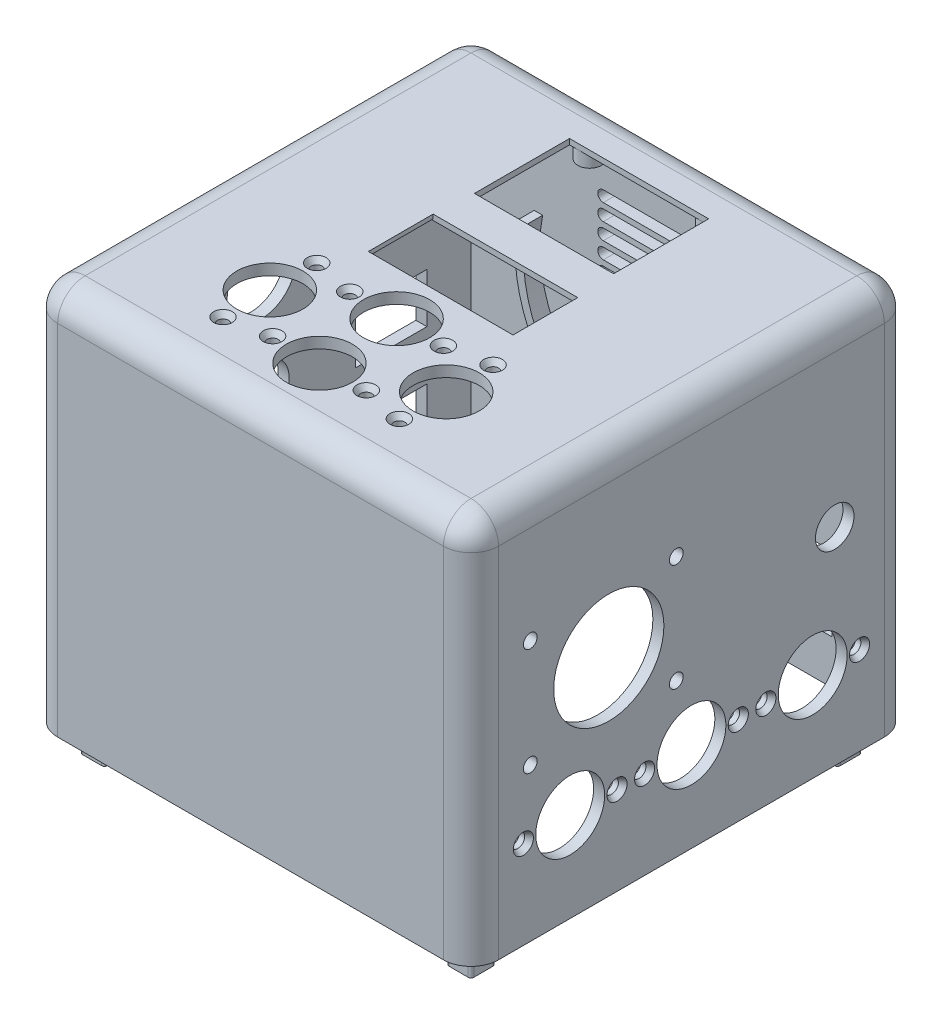
from build123d import *
from OCP.BRepFilletAPI import BRepFilletAPI_MakeChamfer

# Parameters (mm, degrees)
SKETCH1_W              = 80
SKETCH1_H              = 80
BOSS_EXTRUDE1_DEPTH    = 70
SKETCH3_W              = 76
SKETCH3_H              = 76
CUT_EXTRUDE2_DEPTH     = 68
FILLET2_R              = 5
SKETCH4_R              = 2.5
CUT_EXTRUDE4_DEPTH     = 11
SKETCH11_W             = 70
SKETCH11_H             = 65
CUT_EXTRUDE5_DEPTH     = 1.5
SKETCH12_W             = 25.25
SKETCH12_H             = 17.25
SKETCH12_W_2           = 26.25
SKETCH12_H_2           = 11.75
CUT_EXTRUDE6_DEPTH     = 7.5
SKETCH13_R             = 3.5
SKETCH13_R_2           = 10
CUT_EXTRUDE7_DEPTH     = 7.5
SKETCH14_W             = 7
SKETCH14_H             = 9
BOSS_EXTRUDE4_DEPTH    = 7
CUT_EXTRUDE8_DEPTH     = 8
SKETCH17_R             = 1
CUT_EXTRUDE9_DEPTH     = 3
CHAMFER1_SIZE          = 2
FILLET7_R              = 0.5
CIRPATTERN2_COUNT      = 4
SKETCH21_W             = 28.25
SKETCH21_H             = 28.05
SKETCH21_W_2           = 25.25
SKETCH21_H_2           = 17.25
CUT_EXTRUDE11_DEPTH    = 1
SKETCH22_W             = 12
SKETCH22_H             = 2.75
CUT_EXTRUDE12_DEPTH    = 0.75
SKETCH23_W             = 5
SKETCH23_H             = 11.75
CUT_EXTRUDE13_DEPTH    = 1.85
SKETCH24_W             = 6
SKETCH24_H             = 11.75
CUT_EXTRUDE14_DEPTH    = 1.25
SKETCH25_W             = 4
SKETCH25_H             = 9.25
CUT_EXTRUDE15_DEPTH    = 0.5
SKETCH26_W             = 39.25
SKETCH26_H             = 13.75
SKETCH26_W_2           = 26.25
SKETCH26_H_2           = 11.75
CUT_EXTRUDE16_DEPTH    = 1
SKETCH27_R             = 2.125
SKETCH27_R_2           = 1.125
BOSS_EXTRUDE6_DEPTH    = 2.5
SKETCH29_R             = 2.125
SKETCH29_R_2           = 1.125
BOSS_EXTRUDE7_DEPTH    = 2.5
SKETCH31_W             = 2
SKETCH31_H             = 60
SKETCH31_W_2           = 60
SKETCH31_H_2           = 2
EXTRUDE_THIN1_DEPTH    = 3
BOSS_EXTRUDE9_DEPTH    = 5
SKETCH34_W             = 3.5
SKETCH34_H             = 2.25
SKETCH34_W_2           = 2.25
SKETCH34_H_2           = 3.5
CUT_EXTRUDE17_DEPTH    = 1.25
SKETCH37_W             = 30
SKETCH37_H             = 2
CUT_EXTRUDE18_DEPTH    = 5
FILLET6_R              = 1
LPATTERN1_COUNT        = 10
LPATTERN1_PITCH        = 3
FILLET6_OF_LPATTERN1_R = 1
BOSS_EXTRUDE11_DEPTH   = 3
SKETCH41_R             = 5
SKETCH41_R_2           = 6.25
SKETCH41_R_3           = 1.25
SKETCH41_W             = 13
SKETCH41_H             = 9
SKETCH41_W_2           = 8
SKETCH41_H_2           = 4
CUT_EXTRUDE19_DEPTH    = 5
SKETCH42_R             = 6
CUT_EXTRUDE20_DEPTH    = 5
SKETCH43_R             = 6.25
CUT_EXTRUDE21_DEPTH    = 5
SKETCH44_W             = 9
SKETCH44_H             = 13.5
CUT_EXTRUDE22_DEPTH    = 5
SKETCH45_R             = 1
CUT_EXTRUDE23_DEPTH    = 3
SKETCH46_R             = 1
CUT_EXTRUDE24_DEPTH    = 2
CUT_EXTRUDE25_START    = -2
SKETCH47_R             = 6.25
SKETCH47_R_2           = 1.25
CUT_EXTRUDE25_DEPTH    = 2
SKETCH48_R             = 0.75
CUT_EXTRUDE26_DEPTH    = 2
SKETCH36_R             = 1.25
CUT_EXTRUDE27_DEPTH    = 10
CHAMFER3_SIZE          = 1
CHAMFER3_SIZE2         = 0.700207538
SKETCH50_W             = 62
SKETCH50_H             = 2
CUT_EXTRUDE28_DEPTH    = 2
CUT_EXTRUDE29_START    = -14
SKETCH49_R             = 1.125
SKETCH49_R_2           = 5
CUT_EXTRUDE29_DEPTH    = 14
CHAMFER2_SIZE          = 1
CHAMFER2_SIZE2         = 0.577350269


with BuildPart() as part:
    # Sketch1 → Boss-Extrude1 (new body)
    with BuildSketch(Plane(origin=(0, 0, 0), x_dir=(1, 0, 0), z_dir=(0, 1, 0))):
        Rectangle(SKETCH1_W, SKETCH1_H)
    extrude(amount=-BOSS_EXTRUDE1_DEPTH)

    # Sketch3 → Cut-Extrude2 (cut)
    with BuildSketch(Plane.XZ.offset(70)):
        Rectangle(SKETCH3_W, SKETCH3_H)
    extrude(amount=-CUT_EXTRUDE2_DEPTH, mode=Mode.SUBTRACT)

    # Fillet2
    fillet2_edges = [part.edges().sort_by_distance(p)[0] for p in [
        (38, -2, 0),
        (-38, -2, 0),
        (0, 0, 40),
        (-40, 0, 0),
        (0, 0, -40),
        (40, 0, 0),
        (40, -35, 40),
        (-40, -35, 40),
        (-40, -35, -40),
        (40, -35, -40),
    ]]
    fillet(fillet2_edges, radius=FILLET2_R)

    # Sketch4 → Cut-Extrude4 (cut)
    with BuildSketch(Plane(origin=(0, 0, -40), x_dir=(-1, 0, 0), z_dir=(0, 0, -1))):
        with Locations((0, -59)):
            Circle(SKETCH4_R)
    extrude(amount=-CUT_EXTRUDE4_DEPTH, mode=Mode.SUBTRACT)

    # Sketch11 → Cut-Extrude5 (cut)
    with BuildSketch(Plane(origin=(0, 0, 38), x_dir=(-1, 0, 0), z_dir=(0, 0, -1))):
        with Locations((0, -37.5)):
            Rectangle(SKETCH11_W, SKETCH11_H)
    extrude(amount=-CUT_EXTRUDE5_DEPTH, mode=Mode.SUBTRACT)

    # Sketch12 → Cut-Extrude6 (cut)
    with BuildSketch(Plane(origin=(0, 0, 0), x_dir=(1, 0, 0), z_dir=(0, 1, 0))):
        with Locations((0, 21.875)):
            Rectangle(SKETCH12_W, SKETCH12_H)
        with Locations((0, 0.375)):
            Rectangle(SKETCH12_W_2, SKETCH12_H_2)
    extrude(amount=-CUT_EXTRUDE6_DEPTH, mode=Mode.SUBTRACT)

    # Sketch13 → Cut-Extrude7 (cut)
    with BuildSketch(Plane(origin=(40, 0, 0), x_dir=(0, 0, -1), z_dir=(1, 0, 0))):
        with Locations((26, -32.5)):
            Circle(SKETCH13_R)
        with Locations((-15, -32.5)):
            Circle(SKETCH13_R_2)
    extrude(amount=-CUT_EXTRUDE7_DEPTH, mode=Mode.SUBTRACT)

    # Sketch21 → Cut-Extrude11 (cut)
    with BuildSketch(Plane.XZ.offset(2)):
        with Locations((0, -21.875)):
            Rectangle(SKETCH21_W, SKETCH21_H)
        with Locations((0, -21.875)):
            Rectangle(SKETCH21_W_2, SKETCH21_H_2, mode=Mode.SUBTRACT)
    extrude(amount=-CUT_EXTRUDE11_DEPTH, mode=Mode.SUBTRACT)

    # Sketch22 → Cut-Extrude12 (cut)
    with BuildSketch(Plane.XZ.offset(1)):
        with Locations((0, -9.725)):
            Rectangle(SKETCH22_W, SKETCH22_H)
    extrude(amount=-CUT_EXTRUDE12_DEPTH, mode=Mode.SUBTRACT)

    # Sketch23 → Cut-Extrude13 (cut)
    with BuildSketch(Plane.XZ.offset(2)):
        with Locations((15.625, -0.375)):
            Rectangle(SKETCH23_W, SKETCH23_H)
    extrude(amount=-CUT_EXTRUDE13_DEPTH, mode=Mode.SUBTRACT)

    # Sketch24 → Cut-Extrude14 (cut)
    with BuildSketch(Plane.XZ.offset(2)):
        with Locations((-16.125, -0.375)):
            Rectangle(SKETCH24_W, SKETCH24_H)
    extrude(amount=-CUT_EXTRUDE14_DEPTH, mode=Mode.SUBTRACT)

    # Sketch25 → Cut-Extrude15 (cut)
    with BuildSketch(Plane.XZ.offset(0.75)):
        with Locations((-16.625, -0.375)):
            Rectangle(SKETCH25_W, SKETCH25_H)
    extrude(amount=-CUT_EXTRUDE15_DEPTH, mode=Mode.SUBTRACT)

    # Sketch26 → Cut-Extrude16 (cut)
    with BuildSketch(Plane.XZ.offset(2)):
        with Locations((-0.5, -0.375)):
            Rectangle(SKETCH26_W, SKETCH26_H)
        with Locations((0, -0.375)):
            Rectangle(SKETCH26_W_2, SKETCH26_H_2, mode=Mode.SUBTRACT)
    extrude(amount=-CUT_EXTRUDE16_DEPTH, mode=Mode.SUBTRACT)

    # Sketch27 → Boss-Extrude6 (add)
    # profile 1 of 2: a face of its own
    with BuildSketch(Plane.XZ.offset(1)):
        with Locations(Location((-11.125, -11.1, 0), (0, 0, 90))):
            Circle(SKETCH27_R)
        with Locations(Location((-11.125, -11.1, 0), (0, 0, 270))):
            Circle(SKETCH27_R_2, mode=Mode.SUBTRACT)
    # profile 2 of 2: a face of its own
    with BuildSketch(Plane.XZ.offset(1)):
        with Locations(Location((-11.125, -32.65, 0), (0, 0, 90))):
            Circle(SKETCH27_R)
        with Locations(Location((-11.125, -32.65, 0), (0, 0, 270))):
            Circle(SKETCH27_R_2, mode=Mode.SUBTRACT)
    boss_extrude6 = extrude(amount=BOSS_EXTRUDE6_DEPTH)

    # Mirror1: Boss-Extrude6 across plane
    add(boss_extrude6.mirror(Plane(origin=(0, 0, 0), x_dir=(0, 0, 1), z_dir=(1, 0, 0))))

    # Sketch29 → Boss-Extrude7 (add)
    with BuildSketch(Plane.XZ.offset(2)):
        with Locations(Location((-22.5, -0.375, 0), (0, 0, 90))):
            Circle(SKETCH29_R)
        with Locations(Location((-22.5, -0.375, 0), (0, 0, 270))):
            Circle(SKETCH29_R_2, mode=Mode.SUBTRACT)
    boss_extrude7 = extrude(amount=BOSS_EXTRUDE7_DEPTH)

    # Mirror2: Boss-Extrude7 across plane
    add(boss_extrude7.mirror(Plane(origin=(0, 0, 0), x_dir=(0, 0, 1), z_dir=(1, 0, 0))))



with BuildPart() as body_2:
    # Sketch14 → Boss-Extrude4 (new body)
    with BuildSketch(Plane(origin=(-38, 0, 0), x_dir=(0, 0, -1), z_dir=(1, 0, 0))):
        with Locations((34.5, -70.5)):
            Rectangle(SKETCH14_W, SKETCH14_H)
    extrude(amount=BOSS_EXTRUDE4_DEPTH)

    # Sketch16 → Cut-Extrude8 (cut)
    with BuildSketch(Plane.XZ.offset(75)):
        Polygon((-38, -31), (-38, -38), (-31, -38), (-31, -35.5), (-35.5, -35.5), (-35.5, -31), align=None)
    extrude(amount=-CUT_EXTRUDE8_DEPTH, mode=Mode.SUBTRACT)

    # Sketch17 → Cut-Extrude9 (cut)
    with BuildSketch(Plane.XZ.offset(75)):
        with Locations(Location((-33.25, -33.25, 0), (0, 0, 270))):
            Circle(SKETCH17_R)
    extrude(amount=-CUT_EXTRUDE9_DEPTH, mode=Mode.SUBTRACT)

    # Chamfer1
    chamfer1_edges = [body_2.edges().sort_by_distance(p)[0] for p in [
        (-31, -70.5, -31),
    ]]
    chamfer(chamfer1_edges, length=CHAMFER1_SIZE)

    # Fillet7
    fillet7_edges = [body_2.edges().sort_by_distance(p)[0] for p in [
        (-35.5, -71, -31),
        (-35.5, -71, -35.5),
        (-31, -71, -35.5),
        (-31, -70.5, -33),
        (-33, -70.5, -31),
    ]]
    fillet(fillet7_edges, radius=FILLET7_R)


with BuildPart() as cirpattern2_1:
    # CirPattern2: pattern copy
    add(body_2.part.rotate(Axis((0, 0, 0), (0, 1, 0)), 1 * 360 / CIRPATTERN2_COUNT))


with BuildPart() as cirpattern2_2:
    # CirPattern2: pattern copy
    add(body_2.part.rotate(Axis((0, 0, 0), (0, 1, 0)), 2 * 360 / CIRPATTERN2_COUNT))


with BuildPart() as cirpattern2_3:
    # CirPattern2: pattern copy
    add(body_2.part.rotate(Axis((0, 0, 0), (0, 1, 0)), 3 * 360 / CIRPATTERN2_COUNT))


with BuildPart() as part_1:
    add(part.part)

    add(cirpattern2_1.part)  # Extrude-Thin1 merges CirPattern2_1

    add(cirpattern2_2.part)  # Extrude-Thin1 merges CirPattern2_2
    # Sketch31 → Extrude-Thin1 (add)
    with BuildSketch(Plane(origin=(0, 0, 39.5), x_dir=(-1, 0, 0), z_dir=(0, 0, -1))):
        with Locations((0, -37)):
            Rectangle(SKETCH31_W, SKETCH31_H)
        with Locations((0, -37)):
            Rectangle(SKETCH31_W_2, SKETCH31_H_2)
        with Locations((-15, -37)):
            Rectangle(SKETCH31_W, SKETCH31_H)
        Polygon((-29, -67), (-29, -8), (29, -8), (29, -67), (31, -67), (31, -6), (-31, -6), (-31, -67), align=None)
        with Locations((15, -37)):
            Rectangle(SKETCH31_W, SKETCH31_H)
        with Locations((0, -22)):
            Rectangle(SKETCH31_W_2, SKETCH31_H_2)
        with Locations((0, -52)):
            Rectangle(SKETCH31_W_2, SKETCH31_H_2)
    extrude(amount=EXTRUDE_THIN1_DEPTH)

    # Sketch33 → Boss-Extrude9 (add)
    with BuildSketch(Plane.XY.offset(-38)):
        with BuildLine():
            Line((-5.454356057, -56.5), (-7.071067812, -56.5))
            ThreePointArc((-7.071067812, -56.5), (-1.26826484, -66.391989197), (7.5, -59))
            ThreePointArc((7.5, -59), (7.391989197, -57.73173516), (7.071067812, -56.5))
            Line((7.071067812, -56.5), (5.454356057, -56.5))
            ThreePointArc((5.454356057, -56.5), (5.862002062, -57.720573633), (6, -59))
            ThreePointArc((6, -59), (-1.279426367, -64.862002062), (-5.454356057, -56.5))
        make_face()
    extrude(amount=BOSS_EXTRUDE9_DEPTH)

    # Sketch34 → Cut-Extrude17 (cut)
    with BuildSketch(Plane.ZY.offset(-38)):
        with Locations((-26, -40.625)):
            Rectangle(SKETCH34_W, SKETCH34_H)
        with Locations((-17.875, -32.5)):
            Rectangle(SKETCH34_W_2, SKETCH34_H_2)
        with Locations((-34.125, -32.5)):
            Rectangle(SKETCH34_W_2, SKETCH34_H_2)
        with Locations((-26, -24.375)):
            Rectangle(SKETCH34_W, SKETCH34_H)
    extrude(amount=-CUT_EXTRUDE17_DEPTH, mode=Mode.SUBTRACT)

    # Sketch37 → Cut-Extrude18 (cut)
    with BuildSketch(Plane(origin=(0, 0, -40), x_dir=(-1, 0, 0), z_dir=(0, 0, -1))):
        with Locations((0, -40.5)):
            Rectangle(SKETCH37_W, SKETCH37_H)
    cut_extrude18 = extrude(amount=-CUT_EXTRUDE18_DEPTH, mode=Mode.SUBTRACT)

    # Fillet6
    fillet6_edges = [part_1.edges().sort_by_distance(p)[0] for p in [
        (-15, -39.5, -39),
        (-15, -41.5, -39),
        (15, -39.5, -39),
        (15, -41.5, -39),
    ]]
    fillet(fillet6_edges, radius=FILLET6_R - 0.0001)  # a hair under: the kernel refuses the full size

    # LPattern1: Cut-Extrude18 ×10
    with Locations(*[(0, i * LPATTERN1_PITCH, 0) for i in range(1, LPATTERN1_COUNT)]):
        add(cut_extrude18, mode=Mode.SUBTRACT)

    # Fillet6 of LPattern1
    fillet6_of_lpattern1_edges = [part_1.edges().sort_by_distance(p)[0] for p in [
        (-15, -36.5, -39),
        (-15, -38.5, -39),
        (15, -36.5, -39),
        (15, -38.5, -39),
        (-15, -33.5, -39),
        (-15, -35.5, -39),
        (15, -33.5, -39),
        (15, -35.5, -39),
        (-15, -30.5, -39),
        (-15, -32.5, -39),
        (15, -30.5, -39),
        (15, -32.5, -39),
        (-15, -27.5, -39),
        (-15, -29.5, -39),
        (15, -27.5, -39),
        (15, -29.5, -39),
        (-15, -24.5, -39),
        (-15, -26.5, -39),
        (15, -24.5, -39),
        (15, -26.5, -39),
        (-15, -21.5, -39),
        (-15, -23.5, -39),
        (15, -21.5, -39),
        (15, -23.5, -39),
        (-15, -18.5, -39),
        (-15, -20.5, -39),
        (15, -18.5, -39),
        (15, -20.5, -39),
        (-15, -15.5, -39),
        (-15, -17.5, -39),
        (15, -15.5, -39),
        (15, -17.5, -39),
        (-15, -12.5, -39),
        (-15, -14.5, -39),
        (15, -12.5, -39),
        (15, -14.5, -39),
    ]]
    fillet(fillet6_of_lpattern1_edges, radius=FILLET6_OF_LPATTERN1_R - 0.0001)  # a hair under: the kernel refuses the full size

    # Sketch39 → Boss-Extrude11 (add)
    with BuildSketch(Plane.XY.offset(-38)):
        with BuildLine():
            Line((-25.0049995, -22), (-26.532998323, -22))
            ThreePointArc((-26.532998323, -22), (-23.661459647, -40.005203857), (-10, -52.079872408))
            Line((-10, -52.079872408), (-10, -50.457408211))
            ThreePointArc((-10, -50.457408211), (-22.556451805, -38.893547914), (-25.0049995, -22))
        make_face()
        with BuildLine():
            ThreePointArc((27, -27), (26.882996064, -24.48911915), (26.532998323, -22))
            Line((26.532998323, -22), (25.0049995, -22))
            ThreePointArc((25.0049995, -22), (25.375948133, -24.487778598), (25.5, -27))
            ThreePointArc((25.5, -27), (21.274985311, -41.05791592), (10, -50.457408211))
            Line((10, -50.457408211), (10, -52.079872408))
            ThreePointArc((10, -52.079872408), (22.349496639, -42.149257408), (27, -27))
        make_face()
    extrude(amount=BOSS_EXTRUDE11_DEPTH)

    # Sketch41 → Cut-Extrude19 (cut)
    with BuildSketch(Plane.ZY.offset(40)):
        with Locations((0, -37.5)):
            Circle(SKETCH41_R)
        with Locations((0, -55.5)):
            Circle(SKETCH41_R_2)
        with Locations((0, -19.5)):
            Circle(SKETCH41_R_2)
        with Locations((17.25, -55.5)):
            Circle(SKETCH41_R_3)
        with Locations((30.75, -55.5)):
            Circle(SKETCH41_R_3)
        with Locations((17.25, -37.5)):
            Circle(SKETCH41_R_3)
        with Locations((30.75, -37.5)):
            Circle(SKETCH41_R_3)
        with Locations((17.25, -19.5)):
            Circle(SKETCH41_R_3)
        with Locations((30.75, -19.5)):
            Circle(SKETCH41_R_3)
        with Locations((-23.5, -55.5)):
            Rectangle(SKETCH41_W, SKETCH41_H)
        with Locations((24, -55.5)):
            Rectangle(SKETCH41_W_2, SKETCH41_H_2)
        with Locations((-23.5, -37.5)):
            Rectangle(SKETCH41_W, SKETCH41_H)
        with Locations((-23.5, -19.5)):
            Rectangle(SKETCH41_W, SKETCH41_H)
        with Locations((24, -37.5)):
            Rectangle(SKETCH41_W_2, SKETCH41_H_2)
        with Locations((24, -19.5)):
            Rectangle(SKETCH41_W_2, SKETCH41_H_2)
    extrude(amount=-CUT_EXTRUDE19_DEPTH, mode=Mode.SUBTRACT)

    # Sketch42 → Cut-Extrude20 (cut)
    with BuildSketch(Plane(origin=(0, 0, 0), x_dir=(1, 0, 0), z_dir=(0, 1, 0))):
        with Locations(Location((0, -13.5, 0), (0, 0, 270))):
            Circle(SKETCH42_R)
        with Locations(Location((0, -27.5, 0), (0, 0, 270))):
            Circle(SKETCH42_R)
        with Locations(Location((-16, -20.5, 0), (0, 0, 270))):
            Circle(SKETCH42_R)
        with Locations(Location((16, -20.5, 0), (0, 0, 270))):
            Circle(SKETCH42_R)
    extrude(amount=-CUT_EXTRUDE20_DEPTH, mode=Mode.SUBTRACT)

    # Sketch43 → Cut-Extrude21 (cut)
    with BuildSketch(Plane(origin=(40, 0, 0), x_dir=(0, 0, -1), z_dir=(1, 0, 0))):
        with Locations((0, -53.75)):
            Circle(SKETCH43_R)
        with Locations((22, -53.75)):
            Circle(SKETCH43_R)
        with Locations((-22, -53.75)):
            Circle(SKETCH43_R)
    extrude(amount=-CUT_EXTRUDE21_DEPTH, mode=Mode.SUBTRACT)

    # Sketch44 → Cut-Extrude22 (cut)
    with BuildSketch(Plane(origin=(0, 0, -40), x_dir=(-1, 0, 0), z_dir=(0, 0, -1))):
        with Locations((-23, -55.25)):
            Rectangle(SKETCH44_W, SKETCH44_H)
    extrude(amount=-CUT_EXTRUDE22_DEPTH, mode=Mode.SUBTRACT)

    # Sketch45 → Cut-Extrude23 (cut)
    with BuildSketch(Plane.XZ.offset(2)):
        with Locations(Location((-16, 29, 0), (0, 0, 270))):
            Circle(SKETCH45_R)
        with Locations(Location((-16, 12, 0), (0, 0, 270))):
            Circle(SKETCH45_R)
        with Locations(Location((16, 12, 0), (0, 0, 270))):
            Circle(SKETCH45_R)
        with Locations(Location((16, 29, 0), (0, 0, 270))):
            Circle(SKETCH45_R)
        with Locations(Location((-8.5, 13.5, 0), (0, 0, 270))):
            Circle(SKETCH45_R)
        with Locations(Location((8.5, 13.5, 0), (0, 0, 270))):
            Circle(SKETCH45_R)
        with Locations(Location((8.5, 27.5, 0), (0, 0, 270))):
            Circle(SKETCH45_R)
        with Locations(Location((-8.5, 27.5, 0), (0, 0, 270))):
            Circle(SKETCH45_R)
    extrude(amount=-CUT_EXTRUDE23_DEPTH, mode=Mode.SUBTRACT)

    # Sketch46 → Cut-Extrude24 (cut)
    with BuildSketch(Plane(origin=(-38, 0, 0), x_dir=(0, 0, -1), z_dir=(1, 0, 0))):
        with Locations((-8.75, -55.5)):
            Circle(SKETCH46_R)
        with Locations(Location((8.75, -55.5, 0), (0, 0, 180))):
            Circle(SKETCH46_R)
        with Locations((8.75, -19.5)):
            Circle(SKETCH46_R)
        with Locations(Location((-8.75, -19.5, 0), (0, 0, 180))):
            Circle(SKETCH46_R)
    extrude(amount=-CUT_EXTRUDE24_DEPTH, mode=Mode.SUBTRACT)

    # Sketch47 → Cut-Extrude25 (cut)
    with BuildSketch(Plane.ZY.offset(-38).offset(CUT_EXTRUDE25_START)):
        with Locations(Location((0, -53.75, 0), (0, 0, 180))):
            Circle(SKETCH47_R)
        with Locations((-8.5, -54)):
            Circle(SKETCH47_R_2)
        with Locations(Location((8.5, -54, 0), (0, 0, 180))):
            Circle(SKETCH47_R_2)
        with Locations((13.5, -54)):
            Circle(SKETCH47_R_2)
        with Locations(Location((30.5, -54, 0), (0, 0, 180))):
            Circle(SKETCH47_R_2)
        with Locations((-30.5, -54)):
            Circle(SKETCH47_R_2)
        with Locations(Location((-13.5, -54, 0), (0, 0, 180))):
            Circle(SKETCH47_R_2)
    extrude(amount=CUT_EXTRUDE25_DEPTH, mode=Mode.SUBTRACT)

    # Sketch48 → Cut-Extrude26 (cut)
    with BuildSketch(Plane(origin=(0, 0, 36.5), x_dir=(-1, 0, 0), z_dir=(0, 0, -1))):
        with Locations((0, -22)):
            Circle(SKETCH48_R)
        with Locations((15, -37)):
            Circle(SKETCH48_R)
        with Locations((0, -52)):
            Circle(SKETCH48_R)
        with Locations((-15, -37)):
            Circle(SKETCH48_R)
    extrude(amount=-CUT_EXTRUDE26_DEPTH, mode=Mode.SUBTRACT)

    # Sketch36 → Cut-Extrude27 (cut)
    with BuildSketch(Plane.ZY.offset(-38)):
        with Locations((2.75, -22.75)):
            Circle(SKETCH36_R)
        with Locations((2.75, -42.25)):
            Circle(SKETCH36_R)
        with Locations((29.25, -22.75)):
            Circle(SKETCH36_R)
        with Locations((29.25, -42.25)):
            Circle(SKETCH36_R)
    extrude(amount=-CUT_EXTRUDE27_DEPTH, mode=Mode.SUBTRACT)

    # Chamfer3: one chamfer whose edges measure the first distance from different faces: ONE call of the kernel's chamfer builder (chamfer() names one face for all edges)
    chamfer3_edges_1 = [part_1.edges().sort_by_distance(p)[0] for p in [
        (-8.5, 0, 14.5),
    ]]
    chamfer3_side_1 = [part_1.faces().sort_by_distance(p)[0] for p in [
        (-8.5, -1, 14.5),
    ]]
    chamfer3_edges_2 = [part_1.edges().sort_by_distance(p)[0] for p in [
        (16, 0, 30),
    ]]
    chamfer3_side_2 = [part_1.faces().sort_by_distance(p)[0] for p in [
        (16, -1, 30),
    ]]
    chamfer3_edges_3 = [part_1.edges().sort_by_distance(p)[0] for p in [
        (16, 0, 13),
    ]]
    chamfer3_side_3 = [part_1.faces().sort_by_distance(p)[0] for p in [
        (16, -1, 13),
    ]]
    chamfer3_edges_4 = [part_1.edges().sort_by_distance(p)[0] for p in [
        (-16, 0, 13),
    ]]
    chamfer3_side_4 = [part_1.faces().sort_by_distance(p)[0] for p in [
        (-16, -1, 13),
    ]]
    chamfer3_edges_5 = [part_1.edges().sort_by_distance(p)[0] for p in [
        (8.5, 0, 14.5),
    ]]
    chamfer3_side_5 = [part_1.faces().sort_by_distance(p)[0] for p in [
        (8.5, -1, 14.5),
    ]]
    chamfer3_edges_6 = [part_1.edges().sort_by_distance(p)[0] for p in [
        (8.5, 0, 28.5),
    ]]
    chamfer3_side_6 = [part_1.faces().sort_by_distance(p)[0] for p in [
        (8.5, -1, 28.5),
    ]]
    chamfer3_edges_7 = [part_1.edges().sort_by_distance(p)[0] for p in [
        (-8.5, 0, 28.5),
    ]]
    chamfer3_side_7 = [part_1.faces().sort_by_distance(p)[0] for p in [
        (-8.5, -1, 28.5),
    ]]
    chamfer3_edges_8 = [part_1.edges().sort_by_distance(p)[0] for p in [
        (-16, 0, 30),
    ]]
    chamfer3_side_8 = [part_1.faces().sort_by_distance(p)[0] for p in [
        (-16, -1, 30),
    ]]
    chamfer3 = BRepFilletAPI_MakeChamfer(part_1.part.solid().wrapped)
    for e in chamfer3_edges_1:
        chamfer3.Add(CHAMFER3_SIZE, CHAMFER3_SIZE2, e.wrapped, chamfer3_side_1[0].wrapped)  # the first distance lies on this face
    for e in chamfer3_edges_2:
        chamfer3.Add(CHAMFER3_SIZE, CHAMFER3_SIZE2, e.wrapped, chamfer3_side_2[0].wrapped)  # the first distance lies on this face
    for e in chamfer3_edges_3:
        chamfer3.Add(CHAMFER3_SIZE, CHAMFER3_SIZE2, e.wrapped, chamfer3_side_3[0].wrapped)  # the first distance lies on this face
    for e in chamfer3_edges_4:
        chamfer3.Add(CHAMFER3_SIZE, CHAMFER3_SIZE2, e.wrapped, chamfer3_side_4[0].wrapped)  # the first distance lies on this face
    for e in chamfer3_edges_5:
        chamfer3.Add(CHAMFER3_SIZE, CHAMFER3_SIZE2, e.wrapped, chamfer3_side_5[0].wrapped)  # the first distance lies on this face
    for e in chamfer3_edges_6:
        chamfer3.Add(CHAMFER3_SIZE, CHAMFER3_SIZE2, e.wrapped, chamfer3_side_6[0].wrapped)  # the first distance lies on this face
    for e in chamfer3_edges_7:
        chamfer3.Add(CHAMFER3_SIZE, CHAMFER3_SIZE2, e.wrapped, chamfer3_side_7[0].wrapped)  # the first distance lies on this face
    for e in chamfer3_edges_8:
        chamfer3.Add(CHAMFER3_SIZE, CHAMFER3_SIZE2, e.wrapped, chamfer3_side_8[0].wrapped)  # the first distance lies on this face
    add(Compound.cast(chamfer3.Shape()), mode=Mode.REPLACE)

    # Sketch50 → Cut-Extrude28 (cut)
    with BuildSketch(Plane(origin=(0, 0, 36.5), x_dir=(-1, 0, 0), z_dir=(0, 0, -1))):
        with Locations((0, -66)):
            Rectangle(SKETCH50_W, SKETCH50_H)
    extrude(amount=-CUT_EXTRUDE28_DEPTH, mode=Mode.SUBTRACT)

    # Sketch49 → Cut-Extrude29 (cut)
    with BuildSketch(Plane(origin=(-38, 0, 0), x_dir=(0, 0, -1), z_dir=(1, 0, 0)).offset(CUT_EXTRUDE29_START)):
        with Locations((0, -30)):
            Circle(SKETCH49_R)
        with Locations((0, -45)):
            Circle(SKETCH49_R)
        with Locations(Location((0, -37.5, 0), (0, 0, 180))):
            Circle(SKETCH49_R_2)
    extrude(amount=CUT_EXTRUDE29_DEPTH, mode=Mode.SUBTRACT)

    # Chamfer2: one chamfer whose edges measure the first distance from different faces: ONE call of the kernel's chamfer builder (chamfer() names one face for all edges)
    chamfer2_edges_1 = [part_1.edges().sort_by_distance(p)[0] for p in [
        (-40, -19.5, 7.75),
    ]]
    chamfer2_side_1 = [part_1.faces().sort_by_distance(p)[0] for p in [
        (-39, -19.5, 7.75),
    ]]
    chamfer2_edges_2 = [part_1.edges().sort_by_distance(p)[0] for p in [
        (-40, -19.5, -7.75),
    ]]
    chamfer2_side_2 = [part_1.faces().sort_by_distance(p)[0] for p in [
        (-39, -19.5, -7.75),
    ]]
    chamfer2_edges_3 = [part_1.edges().sort_by_distance(p)[0] for p in [
        (-40, -55.5, -9.75),
    ]]
    chamfer2_side_3 = [part_1.faces().sort_by_distance(p)[0] for p in [
        (-39, -55.5, -9.75),
    ]]
    chamfer2_edges_4 = [part_1.edges().sort_by_distance(p)[0] for p in [
        (-40, -55.5, 9.75),
    ]]
    chamfer2_side_4 = [part_1.faces().sort_by_distance(p)[0] for p in [
        (-39, -55.5, 9.75),
    ]]
    chamfer2_edges_5 = [part_1.edges().sort_by_distance(p)[0] for p in [
        (40, -54, -12.25),
    ]]
    chamfer2_side_5 = [part_1.faces().sort_by_distance(p)[0] for p in [
        (39, -54, -12.25),
    ]]
    chamfer2_edges_6 = [part_1.edges().sort_by_distance(p)[0] for p in [
        (40, -54, -31.75),
    ]]
    chamfer2_side_6 = [part_1.faces().sort_by_distance(p)[0] for p in [
        (39, -54, -31.75),
    ]]
    chamfer2_edges_7 = [part_1.edges().sort_by_distance(p)[0] for p in [
        (40, -54, 31.75),
    ]]
    chamfer2_side_7 = [part_1.faces().sort_by_distance(p)[0] for p in [
        (39, -54, 31.75),
    ]]
    chamfer2_edges_8 = [part_1.edges().sort_by_distance(p)[0] for p in [
        (40, -54, 12.25),
    ]]
    chamfer2_side_8 = [part_1.faces().sort_by_distance(p)[0] for p in [
        (39, -54, 12.25),
    ]]
    chamfer2_edges_9 = [part_1.edges().sort_by_distance(p)[0] for p in [
        (40, -54, 9.75),
    ]]
    chamfer2_side_9 = [part_1.faces().sort_by_distance(p)[0] for p in [
        (39, -54, 9.75),
    ]]
    chamfer2_edges_10 = [part_1.edges().sort_by_distance(p)[0] for p in [
        (40, -54, -9.75),
    ]]
    chamfer2_side_10 = [part_1.faces().sort_by_distance(p)[0] for p in [
        (39, -54, -9.75),
    ]]
    chamfer2 = BRepFilletAPI_MakeChamfer(part_1.part.solid().wrapped)
    for e in chamfer2_edges_1:
        chamfer2.Add(CHAMFER2_SIZE, CHAMFER2_SIZE2, e.wrapped, chamfer2_side_1[0].wrapped)  # the first distance lies on this face
    for e in chamfer2_edges_2:
        chamfer2.Add(CHAMFER2_SIZE, CHAMFER2_SIZE2, e.wrapped, chamfer2_side_2[0].wrapped)  # the first distance lies on this face
    for e in chamfer2_edges_3:
        chamfer2.Add(CHAMFER2_SIZE, CHAMFER2_SIZE2, e.wrapped, chamfer2_side_3[0].wrapped)  # the first distance lies on this face
    for e in chamfer2_edges_4:
        chamfer2.Add(CHAMFER2_SIZE, CHAMFER2_SIZE2, e.wrapped, chamfer2_side_4[0].wrapped)  # the first distance lies on this face
    for e in chamfer2_edges_5:
        chamfer2.Add(CHAMFER2_SIZE, CHAMFER2_SIZE2, e.wrapped, chamfer2_side_5[0].wrapped)  # the first distance lies on this face
    for e in chamfer2_edges_6:
        chamfer2.Add(CHAMFER2_SIZE, CHAMFER2_SIZE2, e.wrapped, chamfer2_side_6[0].wrapped)  # the first distance lies on this face
    for e in chamfer2_edges_7:
        chamfer2.Add(CHAMFER2_SIZE, CHAMFER2_SIZE2, e.wrapped, chamfer2_side_7[0].wrapped)  # the first distance lies on this face
    for e in chamfer2_edges_8:
        chamfer2.Add(CHAMFER2_SIZE, CHAMFER2_SIZE2, e.wrapped, chamfer2_side_8[0].wrapped)  # the first distance lies on this face
    for e in chamfer2_edges_9:
        chamfer2.Add(CHAMFER2_SIZE, CHAMFER2_SIZE2, e.wrapped, chamfer2_side_9[0].wrapped)  # the first distance lies on this face
    for e in chamfer2_edges_10:
        chamfer2.Add(CHAMFER2_SIZE, CHAMFER2_SIZE2, e.wrapped, chamfer2_side_10[0].wrapped)  # the first distance lies on this face
    add(Compound.cast(chamfer2.Shape()), mode=Mode.REPLACE)


solid = Compound([body_2.part, cirpattern2_3.part, part_1.part])
